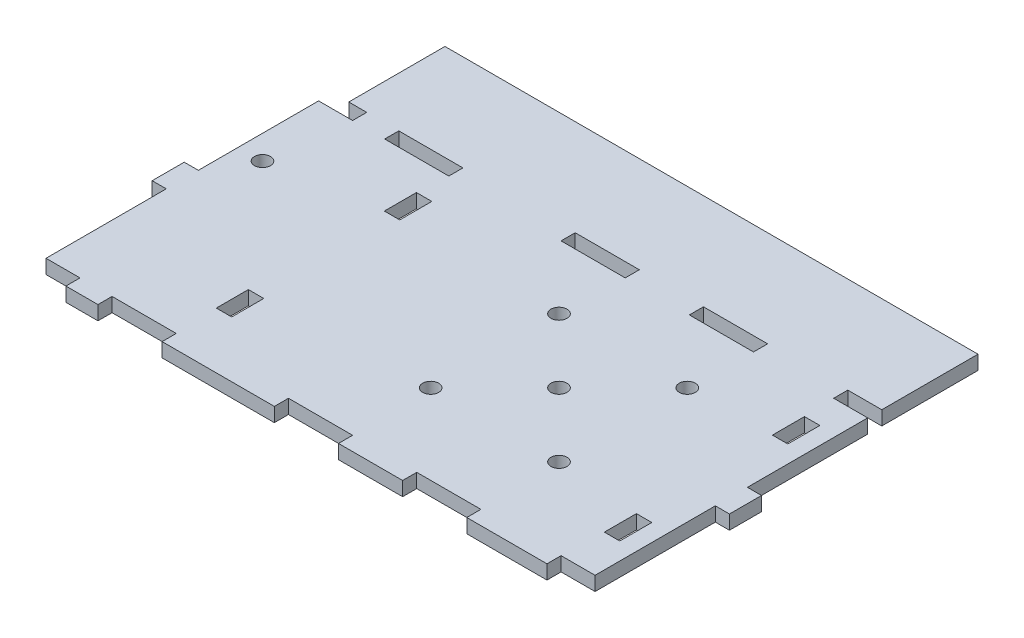
from build123d import *

# Parameters (mm, degrees)
SKETCH1_W           = 25.4
SKETCH1_H           = 5.588
BOSS_EXTRUDE1_DEPTH = 5.588
CUT_EXTRUDE1_REACH  = 152.445
SKETCH9_W           = 6.096
SKETCH9_H           = 12.7
CUT_EXTRUDE2_REACH  = 152.445
SKETCH12_R          = 3.175
CUT_EXTRUDE3_REACH  = 152.445
SKETCH13_R          = 3.175


with BuildPart() as part:
    # Sketch1 → Boss-Extrude1 (new body)
    with BuildSketch(Plane(origin=(0, 0, 0), x_dir=(1, 0, 0), z_dir=(0, 1, 0))):
        Polygon((-108.712, 6.35), (-114.3, 6.35), (-114.3, -6.35), (-108.712, -6.35), (-108.712, -53.975), (-95.25, -53.975), (-95.25, -59.563), (-82.55, -59.563), (-82.55, -53.975), (-57.15, -53.975), (-57.15, -59.563), (-12.7, -59.563), (-12.7, -53.975), (12.7, -53.975), (12.7, -59.563), (38.1, -59.563), (38.1, -53.975), (63.5, -53.975), (63.5, -59.563), (95.25, -59.563), (95.25, -53.975), (108.712, -53.975), (108.712, -6.35), (114.3, -6.35), (114.3, 6.35), (108.712, 6.35), (108.712, 53.975), (95.25, 53.975), (95.25, 59.563), (108.712, 59.563), (108.712, 97.663), (-102.362, 97.663), (-102.362, 59.563), (-95.25, 59.563), (-95.25, 53.975), (-108.712, 53.975), align=None)
        with Locations((-69.85, 56.769)):
            Rectangle(SKETCH1_W, SKETCH1_H, mode=Mode.SUBTRACT)
        with Locations((0, 56.769)):
            Rectangle(SKETCH1_W, SKETCH1_H, mode=Mode.SUBTRACT)
        with Locations((50.8, 56.769)):
            Rectangle(SKETCH1_W, SKETCH1_H, mode=Mode.SUBTRACT)
    extrude(amount=BOSS_EXTRUDE1_DEPTH)

    # Sketch9 → Cut-Extrude1 (cut, up to next)
    with BuildSketch(Plane(origin=(0, 5.588, 0), x_dir=(1, 0, 0), z_dir=(0, 1, 0)), mode=Mode.PRIVATE) as cut_extrude1_sk1:
        with Locations((-54.864, -30.988)):
            Rectangle(SKETCH9_W, SKETCH9_H)
    cut_extrude1_tool1 = extrude(cut_extrude1_sk1.sketch, amount=-CUT_EXTRUDE1_REACH, mode=Mode.PRIVATE) & part.part
    # Sketch9 → Cut-Extrude1 (cut, up to next)
    with BuildSketch(Plane(origin=(0, 5.588, 0), x_dir=(1, 0, 0), z_dir=(0, 1, 0)), mode=Mode.PRIVATE) as cut_extrude1_sk2:
        with Locations((-54.864, 35.56)):
            Rectangle(SKETCH9_W, SKETCH9_H)
    cut_extrude1_tool2 = extrude(cut_extrude1_sk2.sketch, amount=-CUT_EXTRUDE1_REACH, mode=Mode.PRIVATE) & part.part
    # Sketch9 → Cut-Extrude1 (cut, up to next)
    with BuildSketch(Plane(origin=(0, 5.588, 0), x_dir=(1, 0, 0), z_dir=(0, 1, 0)), mode=Mode.PRIVATE) as cut_extrude1_sk3:
        with Locations((98.806, -30.988)):
            Rectangle(SKETCH9_W, SKETCH9_H)
    cut_extrude1_tool3 = extrude(cut_extrude1_sk3.sketch, amount=-CUT_EXTRUDE1_REACH, mode=Mode.PRIVATE) & part.part
    # Sketch9 → Cut-Extrude1 (cut, up to next)
    with BuildSketch(Plane(origin=(0, 5.588, 0), x_dir=(1, 0, 0), z_dir=(0, 1, 0)), mode=Mode.PRIVATE) as cut_extrude1_sk4:
        with Locations((98.806, 35.56)):
            Rectangle(SKETCH9_W, SKETCH9_H)
    cut_extrude1_tool4 = extrude(cut_extrude1_sk4.sketch, amount=-CUT_EXTRUDE1_REACH, mode=Mode.PRIVATE) & part.part
    add(cut_extrude1_tool1.solids().sort_by_distance((-54.864, 5.588, 30.988))[0], mode=Mode.SUBTRACT)
    add(cut_extrude1_tool2.solids().sort_by_distance((-54.864, 5.588, -35.56))[0], mode=Mode.SUBTRACT)
    add(cut_extrude1_tool3.solids().sort_by_distance((98.806, 5.588, 30.988))[0], mode=Mode.SUBTRACT)
    add(cut_extrude1_tool4.solids().sort_by_distance((98.806, 5.588, -35.56))[0], mode=Mode.SUBTRACT)

    # Sketch12 → Cut-Extrude2 (cut, up to next)
    with BuildSketch(Plane(origin=(0, 5.588, 0), x_dir=(1, 0, 0), z_dir=(0, 1, 0)), mode=Mode.PRIVATE) as cut_extrude2_sk1:
        with Locations((-99.187, 22.225)):
            Circle(SKETCH12_R)
    cut_extrude2_tool1 = extrude(cut_extrude2_sk1.sketch, amount=-CUT_EXTRUDE2_REACH, mode=Mode.PRIVATE) & part.part
    add(cut_extrude2_tool1.solids().sort_by_distance((-99.187, 5.588, -22.225))[0], mode=Mode.SUBTRACT)

    # Sketch13 → Cut-Extrude3 (cut, up to next)
    with BuildSketch(Plane.XZ, mode=Mode.PRIVATE) as cut_extrude3_sk1:
        with Locations((62.673131522, 22.225)):
            Circle(SKETCH13_R)
    cut_extrude3_tool1 = extrude(cut_extrude3_sk1.sketch, amount=-CUT_EXTRUDE3_REACH, mode=Mode.PRIVATE) & part.part
    # Sketch13 → Cut-Extrude3 (cut, up to next)
    with BuildSketch(Plane.XZ, mode=Mode.PRIVATE) as cut_extrude3_sk2:
        with Locations((11.873131522, 22.225)):
            Circle(SKETCH13_R)
    cut_extrude3_tool2 = extrude(cut_extrude3_sk2.sketch, amount=-CUT_EXTRUDE3_REACH, mode=Mode.PRIVATE) & part.part
    # Sketch13 → Cut-Extrude3 (cut, up to next)
    with BuildSketch(Plane.XZ, mode=Mode.PRIVATE) as cut_extrude3_sk3:
        with Locations((11.873131522, -28.575)):
            Circle(SKETCH13_R)
    cut_extrude3_tool3 = extrude(cut_extrude3_sk3.sketch, amount=-CUT_EXTRUDE3_REACH, mode=Mode.PRIVATE) & part.part
    # Sketch13 → Cut-Extrude3 (cut, up to next)
    with BuildSketch(Plane.XZ, mode=Mode.PRIVATE) as cut_extrude3_sk4:
        with Locations((62.673131522, -28.575)):
            Circle(SKETCH13_R)
    cut_extrude3_tool4 = extrude(cut_extrude3_sk4.sketch, amount=-CUT_EXTRUDE3_REACH, mode=Mode.PRIVATE) & part.part
    # Sketch13 → Cut-Extrude3 (cut, up to next)
    with BuildSketch(Plane.XZ, mode=Mode.PRIVATE) as cut_extrude3_sk5:
        with Locations((37.273131522, -3.175)):
            Circle(SKETCH13_R)
    cut_extrude3_tool5 = extrude(cut_extrude3_sk5.sketch, amount=-CUT_EXTRUDE3_REACH, mode=Mode.PRIVATE) & part.part
    add(cut_extrude3_tool1.solids().sort_by_distance((62.673132, 0, 22.225))[0], mode=Mode.SUBTRACT)
    add(cut_extrude3_tool2.solids().sort_by_distance((11.873132, 0, 22.225))[0], mode=Mode.SUBTRACT)
    add(cut_extrude3_tool3.solids().sort_by_distance((11.873132, 0, -28.575))[0], mode=Mode.SUBTRACT)
    add(cut_extrude3_tool4.solids().sort_by_distance((62.673132, 0, -28.575))[0], mode=Mode.SUBTRACT)
    add(cut_extrude3_tool5.solids().sort_by_distance((37.273132, 0, -3.175))[0], mode=Mode.SUBTRACT)


solid = part.part
